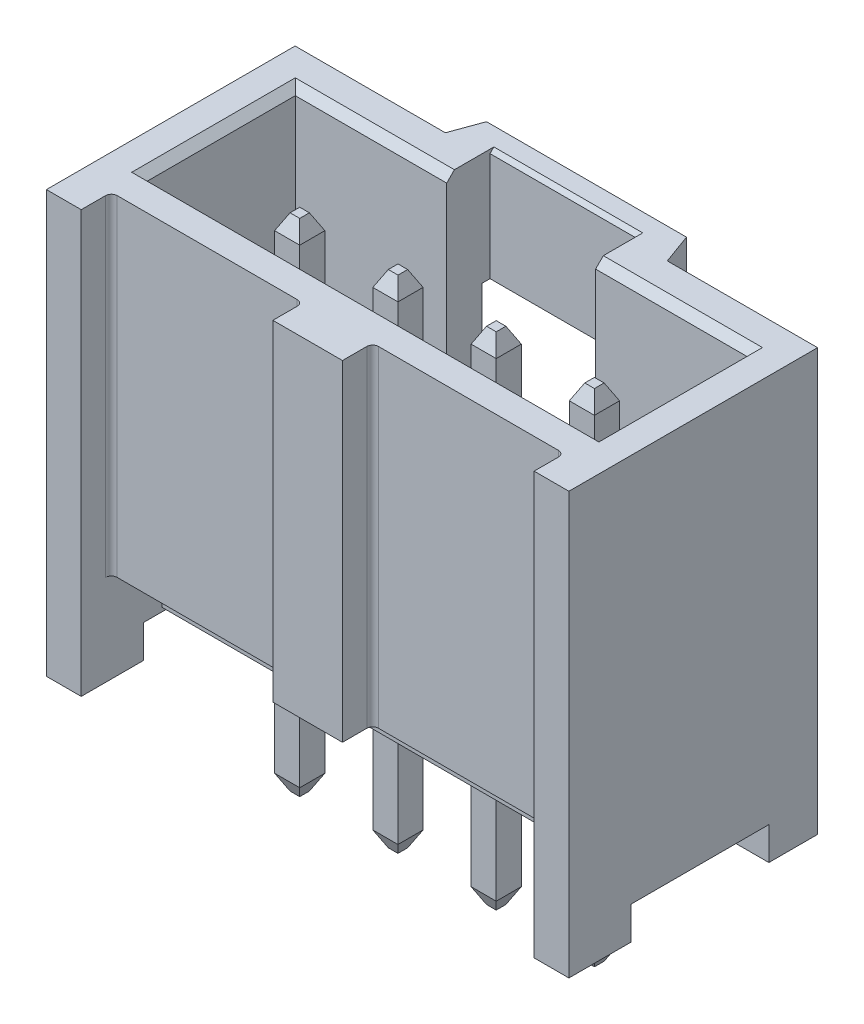
from build123d import *
from OCP.BRepFilletAPI import BRepFilletAPI_MakeChamfer

# Parameters (mm, degrees)
CUT_EXTRUDE1_START       = -8.68
CUT_EXTRUDE1_OUTLINE_W   = 6.64
CUT_EXTRUDE1_OUTLINE_H   = 7.1
CUT_EXTRUDE1_DEPTH       = 4.83
CUT_EXTRUDE1_2_OUTLINE_W = 6.64
CUT_EXTRUDE1_2_OUTLINE_H = 7.1
CUT_EXTRUDE1_2_DEPTH     = 4.83
CUT_EXTRUDE1_START_2     = -3.85
CUT_EXTRUDE1_3_OUTLINE_W = 2.105
CUT_EXTRUDE1_3_OUTLINE_H = 7.1
CUT_EXTRUDE1_3_DEPTH     = 3.85
BOSS_EXTRUDE1_DEPTH      = 2.95
SKETCH3_W                = 3.415
SKETCH3_H                = 7.1
CUT_EXTRUDE2_DEPTH       = 3.915
SKETCH4_W                = 3.415
SKETCH4_H                = 7.1
CUT_EXTRUDE3_DEPTH       = 3.915
SKETCH5_W                = 0.21
SKETCH5_H                = 10.05
CUT_EXTRUDE4_DEPTH       = 4.1696
SKETCH6_W                = 4.83
SKETCH6_H                = 0.21
SKETCH6_W_2              = 0.6604
CUT_EXTRUDE5_DEPTH       = 7.15
SKETCH7_W                = 0.21
SKETCH7_H                = 2.9
CUT_EXTRUDE6_DEPTH       = 4.1696
SKETCH8_W                = 5.1708
SKETCH8_H                = 2.9
BOSS_EXTRUDE2_DEPTH      = 0.57
SKETCH9_W                = 11.71
SKETCH9_H                = 0.78
CUT_EXTRUDE7_DEPTH       = 13.634419259
SKETCH10_W               = 1.8
SKETCH10_H               = 8.55
BOSS_EXTRUDE3_DEPTH      = 0.78
SKETCH11_W               = 11.71
SKETCH11_H               = 1.5
CUT_EXTRUDE8_DEPTH       = 1.31
SKETCH12_W               = 0.9
SKETCH12_H               = 1.61
BOSS_EXTRUDE4_DEPTH      = 0.85
SKETCH13_W               = 0.9
SKETCH13_H               = 1.61
BOSS_EXTRUDE5_DEPTH      = 0.85
CUT_EXTRUDE9_REACH       = 11.866
SKETCH15_W               = 3.85
SKETCH15_H               = 1.5
SKETCH16_W               = 1.74
SKETCH16_H               = 1.5
CUT_EXTRUDE10_DEPTH      = 3.93
SKETCH17_W               = 0.9
SKETCH17_H               = 1.26
BOSS_EXTRUDE6_DEPTH      = 0.85
SKETCH18_W               = 1.74
SKETCH18_H               = 1.5
CUT_EXTRUDE11_DEPTH      = 3.93
SKETCH19_W               = 0.9
SKETCH19_H               = 1.26
BOSS_EXTRUDE7_DEPTH      = 0.85
SKETCH20_W               = 11.68
SKETCH20_H               = 3
CUT_EXTRUDE12_DEPTH      = 0.5
CUT_EXTRUDE13_REACH      = 12.442
SKETCH22_W               = 11.68
SKETCH22_H               = 0.415
SKETCH23_W               = 0.65
SKETCH23_H               = 0.65
BOSS_EXTRUDE8_DEPTH      = 6.75
SKETCH24_W               = 0.65
SKETCH24_H               = 0.65
BOSS_EXTRUDE9_DEPTH      = 6.75
SKETCH25_W               = 0.65
SKETCH25_H               = 0.65
BOSS_EXTRUDE10_DEPTH     = 6.75
SKETCH26_W               = 0.65
SKETCH26_H               = 0.65
BOSS_EXTRUDE11_DEPTH     = 6.75
SKETCH27_W               = 0.65
SKETCH27_H               = 0.65
BOSS_EXTRUDE12_DEPTH     = 3.75
SKETCH28_W               = 0.65
SKETCH28_H               = 0.65
BOSS_EXTRUDE13_DEPTH     = 3.75
SKETCH29_W               = 0.65
SKETCH29_H               = 0.65
BOSS_EXTRUDE14_DEPTH     = 3.75
SKETCH30_W               = 0.65
SKETCH30_H               = 0.65
BOSS_EXTRUDE15_DEPTH     = 3.75
DRAFT1_ANGLE             = 20
CHAMFER1_SIZE            = 0.1
CHAMFER2_SIZE            = 0.2
CHAMFER2_SIZE2           = 0.4
CHAMFER3_SIZE            = 0.2
FILLET1_R                = 0.15


with BuildPart() as part:
    # Cut-Extrude1: read off the stored shape, not the designer's step
    # Cut-Extrude1 outline → Cut-Extrude1 (new body)
    with BuildSketch(Plane(origin=(1.925, 0, 0), x_dir=(0, 0, -1), z_dir=(1, 0, 0)).offset(CUT_EXTRUDE1_START)):
        with Locations((-0.285, 1.9)):
            Rectangle(CUT_EXTRUDE1_OUTLINE_W, CUT_EXTRUDE1_OUTLINE_H)
    extrude(amount=CUT_EXTRUDE1_DEPTH)



with BuildPart() as body_2:
    # Cut-Extrude1 2 outline → Cut-Extrude1 2 (new body)
    with BuildSketch(Plane(origin=(1.925, 0, 0), x_dir=(0, 0, -1), z_dir=(1, 0, 0))):
        with Locations((-0.285, 1.9)):
            Rectangle(CUT_EXTRUDE1_2_OUTLINE_W, CUT_EXTRUDE1_2_OUTLINE_H)
    extrude(amount=CUT_EXTRUDE1_2_DEPTH)


with BuildPart() as part_1:
    add(part.part)

    add(body_2.part)  # Cut-Extrude1 3 merges body 2
    # Cut-Extrude1 3 outline → Cut-Extrude1 3 (add)
    with BuildSketch(Plane(origin=(1.925, 0, 0), x_dir=(0, 0, -1), z_dir=(1, 0, 0)).offset(CUT_EXTRUDE1_START_2)):
        with Locations((-2.5525, 1.9)):
            Rectangle(CUT_EXTRUDE1_3_OUTLINE_W, CUT_EXTRUDE1_3_OUTLINE_H)
    extrude(amount=CUT_EXTRUDE1_3_DEPTH)

    # Sketch2 → Boss-Extrude1 (add)
    with BuildSketch(Plane.XZ.offset(1.65)):
        Polygon((6.755, -3.035), (1.925, -3.035), (1.925, -1.915), (-1.925, -1.915), (-1.925, -3.035), (-6.755, -3.035), (-6.755, 3.605), (6.755, 3.605), align=None)
    extrude(amount=BOSS_EXTRUDE1_DEPTH)

    # Sketch3 → Cut-Extrude2 (cut)
    with BuildSketch(Plane.ZY.offset(-1.925)):
        with Locations((-0.2075, 1.9)):
            Rectangle(SKETCH3_W, SKETCH3_H)
    extrude(amount=-CUT_EXTRUDE2_DEPTH, mode=Mode.SUBTRACT)

    # Sketch4 → Cut-Extrude3 (cut)
    with BuildSketch(Plane(origin=(-1.925, 0, 0), x_dir=(0, 0, -1), z_dir=(1, 0, 0))):
        with Locations((0.2075, 1.9)):
            Rectangle(SKETCH4_W, SKETCH4_H)
    extrude(amount=-CUT_EXTRUDE3_DEPTH, mode=Mode.SUBTRACT)

    # Sketch5 → Cut-Extrude4 (cut)
    with BuildSketch(Plane(origin=(6.755, 0, 0), x_dir=(0, 0, -1), z_dir=(1, 0, 0))):
        with Locations((2.93, 0.425)):
            Rectangle(SKETCH5_W, SKETCH5_H)
    extrude(amount=-CUT_EXTRUDE4_DEPTH, mode=Mode.SUBTRACT)

    # Sketch6 → Cut-Extrude5 (cut)
    with BuildSketch(Plane.XZ.offset(4.6)):
        with Locations((-4.34, -2.93)):
            Rectangle(SKETCH6_W, SKETCH6_H)
        with Locations((2.2552, -2.93)):
            Rectangle(SKETCH6_W_2, SKETCH6_H)
    extrude(amount=-CUT_EXTRUDE5_DEPTH, mode=Mode.SUBTRACT)

    # Sketch7 → Cut-Extrude6 (cut)
    with BuildSketch(Plane.ZY.offset(6.755)):
        with Locations((-2.93, 4)):
            Rectangle(SKETCH7_W, SKETCH7_H)
    extrude(amount=-CUT_EXTRUDE6_DEPTH, mode=Mode.SUBTRACT)

    # Sketch8 → Boss-Extrude2 (add)
    with BuildSketch(Plane(origin=(0, 0, -3.035), x_dir=(-1, 0, 0), z_dir=(0, 0, -1))):
        with Locations((0, 4)):
            Rectangle(SKETCH8_W, SKETCH8_H)
    extrude(amount=BOSS_EXTRUDE2_DEPTH)

    # Sketch9 → Cut-Extrude7 (cut, through all)
    with BuildSketch(Plane.XZ.offset(4.6)):
        with Locations((0, 3.215)):
            Rectangle(SKETCH9_W, SKETCH9_H)
    extrude(amount=-CUT_EXTRUDE7_DEPTH, mode=Mode.SUBTRACT)

    # Sketch10 → Boss-Extrude3 (add)
    with BuildSketch(Plane.XY.offset(2.825)):
        with Locations((0, 1.175)):
            Rectangle(SKETCH10_W, SKETCH10_H)
    extrude(amount=BOSS_EXTRUDE3_DEPTH)

    # Sketch11 → Cut-Extrude8 (cut)
    with BuildSketch(Plane.XY.offset(2.825)):
        with Locations((0, -3.85)):
            Rectangle(SKETCH11_W, SKETCH11_H)
    extrude(amount=-CUT_EXTRUDE8_DEPTH, mode=Mode.SUBTRACT)

    # Sketch12 → Boss-Extrude4 (add)
    with BuildSketch(Plane.XZ.offset(4.6)):
        with Locations((6.305, 2.8)):
            Rectangle(SKETCH12_W, SKETCH12_H)
    extrude(amount=BOSS_EXTRUDE4_DEPTH)

    # Sketch13 → Boss-Extrude5 (add)
    with BuildSketch(Plane.XZ.offset(4.6)):
        with Locations((-6.305, 2.8)):
            Rectangle(SKETCH13_W, SKETCH13_H)
    extrude(amount=BOSS_EXTRUDE5_DEPTH)

    # Sketch15 → Cut-Extrude9 (cut, up to next)
    with BuildSketch(Plane.XY.offset(-1.085), mode=Mode.PRIVATE) as cut_extrude9_sk1:
        with Locations((0, -3.85)):
            Rectangle(SKETCH15_W, SKETCH15_H)
    cut_extrude9_tool1 = extrude(cut_extrude9_sk1.sketch, amount=-CUT_EXTRUDE9_REACH, mode=Mode.PRIVATE) & part_1.part
    add(cut_extrude9_tool1.solids().sort_by_distance((0, -3.85, -1.085))[0], mode=Mode.SUBTRACT)

    # Sketch16 → Cut-Extrude10 (cut)
    with BuildSketch(Plane.ZY.offset(-1.925)):
        with Locations((-1.955, -3.85)):
            Rectangle(SKETCH16_W, SKETCH16_H)
    extrude(amount=-CUT_EXTRUDE10_DEPTH, mode=Mode.SUBTRACT)

    # Sketch17 → Boss-Extrude6 (add)
    with BuildSketch(Plane.XZ.offset(4.6)):
        with Locations((6.305, -2.195)):
            Rectangle(SKETCH17_W, SKETCH17_H)
    extrude(amount=BOSS_EXTRUDE6_DEPTH)

    # Sketch18 → Cut-Extrude11 (cut)
    with BuildSketch(Plane(origin=(-1.925, 0, 0), x_dir=(0, 0, -1), z_dir=(1, 0, 0))):
        with Locations((1.955, -3.85)):
            Rectangle(SKETCH18_W, SKETCH18_H)
    extrude(amount=-CUT_EXTRUDE11_DEPTH, mode=Mode.SUBTRACT)

    # Sketch19 → Boss-Extrude7 (add)
    with BuildSketch(Plane.XZ.offset(4.6)):
        with Locations((-6.305, -2.195)):
            Rectangle(SKETCH19_W, SKETCH19_H)
    extrude(amount=BOSS_EXTRUDE7_DEPTH)

    # Sketch20 → Cut-Extrude12 (cut)
    with BuildSketch(Plane(origin=(0, -1.65, 0), x_dir=(-1, 0, 0), z_dir=(0, 1, 0))):
        Rectangle(SKETCH20_W, SKETCH20_H)
    extrude(amount=-CUT_EXTRUDE12_DEPTH, mode=Mode.SUBTRACT)

    # Sketch22 → Cut-Extrude13 (cut, up to next)
    with BuildSketch(Plane.XZ.offset(1.65), mode=Mode.PRIVATE) as cut_extrude13_sk1:
        with Locations((0, 1.7075)):
            Rectangle(SKETCH22_W, SKETCH22_H)
    cut_extrude13_tool1 = extrude(cut_extrude13_sk1.sketch, amount=-CUT_EXTRUDE13_REACH, mode=Mode.PRIVATE) & part_1.part
    add(cut_extrude13_tool1.solids().sort_by_distance((0, -1.65, 1.7075))[0], mode=Mode.SUBTRACT)

    # Sketch23 → Boss-Extrude8 (add)
    with BuildSketch(Plane(origin=(0, -2.15, 0), x_dir=(-1, 0, 0), z_dir=(0, 1, 0))):
        with Locations((3.81, 0)):
            Rectangle(SKETCH23_W, SKETCH23_H)
    extrude(amount=BOSS_EXTRUDE8_DEPTH)

    # Sketch24 → Boss-Extrude9 (add)
    with BuildSketch(Plane(origin=(0, -2.15, 0), x_dir=(-1, 0, 0), z_dir=(0, 1, 0))):
        with Locations((1.27, 0)):
            Rectangle(SKETCH24_W, SKETCH24_H)
    extrude(amount=BOSS_EXTRUDE9_DEPTH)

    # Sketch25 → Boss-Extrude10 (add)
    with BuildSketch(Plane(origin=(0, -2.15, 0), x_dir=(-1, 0, 0), z_dir=(0, 1, 0))):
        with Locations((-1.27, 0)):
            Rectangle(SKETCH25_W, SKETCH25_H)
    extrude(amount=BOSS_EXTRUDE10_DEPTH)

    # Sketch26 → Boss-Extrude11 (add)
    with BuildSketch(Plane(origin=(0, -2.15, 0), x_dir=(-1, 0, 0), z_dir=(0, 1, 0))):
        with Locations((-3.81, 0)):
            Rectangle(SKETCH26_W, SKETCH26_H)
    extrude(amount=BOSS_EXTRUDE11_DEPTH)

    # Sketch27 → Boss-Extrude12 (add)
    with BuildSketch(Plane.XZ.offset(4.6)):
        with Locations((-3.81, 0)):
            Rectangle(SKETCH27_W, SKETCH27_H)
    extrude(amount=BOSS_EXTRUDE12_DEPTH)

    # Sketch28 → Boss-Extrude13 (add)
    with BuildSketch(Plane.XZ.offset(4.6)):
        with Locations((-1.27, 0)):
            Rectangle(SKETCH28_W, SKETCH28_H)
    extrude(amount=BOSS_EXTRUDE13_DEPTH)

    # Sketch29 → Boss-Extrude14 (add)
    with BuildSketch(Plane.XZ.offset(4.6)):
        with Locations((1.27, 0)):
            Rectangle(SKETCH29_W, SKETCH29_H)
    extrude(amount=BOSS_EXTRUDE14_DEPTH)

    # Sketch30 → Boss-Extrude15 (add)
    with BuildSketch(Plane.XZ.offset(4.6)):
        with Locations((3.81, 0)):
            Rectangle(SKETCH30_W, SKETCH30_H)
    extrude(amount=BOSS_EXTRUDE15_DEPTH)

    # Draft1
    draft1_faces = [part_1.faces().sort_by_distance(p)[0] for p in [
        (-2.5854, 4, -3.215),
        (2.5854, 4, -3.215),
    ]]
    draft(draft1_faces, Plane(origin=(0, 0, -3.605), x_dir=(-1, 0, 0), z_dir=(0, 0, -1)), DRAFT1_ANGLE)

    # Chamfer1
    chamfer1_edges = [part_1.edges().sort_by_distance(p)[0] for p in [
        (0, 5.45, -3.035),
        (0, -4.6, 1.515),
        (0, -4.6, -1.085),
    ]]
    chamfer(chamfer1_edges, length=CHAMFER1_SIZE)

    # Chamfer2: one chamfer whose edges measure the first distance from different faces: ONE call of the kernel's chamfer builder (chamfer() names one face for all edges)
    chamfer2_edges_1 = [part_1.edges().sort_by_distance(p)[0] for p in [
        (-4.135, 4.6, 0),
        (-3.81, 4.6, 0.325),
        (-3.485, 4.6, 0),
        (-3.81, 4.6, -0.325),
    ]]
    chamfer2_side_1 = [part_1.faces().sort_by_distance(p)[0] for p in [
        (-3.81, 4.6, 0),
    ]]
    chamfer2_edges_2 = [part_1.edges().sort_by_distance(p)[0] for p in [
        (-1.27, 4.6, -0.325),
        (-1.595, 4.6, 0),
        (-1.27, 4.6, 0.325),
        (-0.945, 4.6, 0),
    ]]
    chamfer2_side_2 = [part_1.faces().sort_by_distance(p)[0] for p in [
        (-1.27, 4.6, 0),
    ]]
    chamfer2_edges_3 = [part_1.edges().sort_by_distance(p)[0] for p in [
        (0.945, 4.6, 0),
        (1.27, 4.6, 0.325),
        (1.595, 4.6, 0),
        (1.27, 4.6, -0.325),
    ]]
    chamfer2_side_3 = [part_1.faces().sort_by_distance(p)[0] for p in [
        (1.27, 4.6, 0),
    ]]
    chamfer2_edges_4 = [part_1.edges().sort_by_distance(p)[0] for p in [
        (3.81, 4.6, -0.325),
        (3.485, 4.6, 0),
        (3.81, 4.6, 0.325),
        (4.135, 4.6, 0),
    ]]
    chamfer2_side_4 = [part_1.faces().sort_by_distance(p)[0] for p in [
        (3.81, 4.6, 0),
    ]]
    chamfer2_edges_5 = [part_1.edges().sort_by_distance(p)[0] for p in [
        (-3.81, -8.35, -0.325),
        (-3.485, -8.35, 0),
        (-3.81, -8.35, 0.325),
        (-4.135, -8.35, 0),
    ]]
    chamfer2_side_5 = [part_1.faces().sort_by_distance(p)[0] for p in [
        (-3.81, -8.35, 0),
    ]]
    chamfer2_edges_6 = [part_1.edges().sort_by_distance(p)[0] for p in [
        (-1.27, -8.35, -0.325),
        (-0.945, -8.35, 0),
        (-1.27, -8.35, 0.325),
        (-1.595, -8.35, 0),
    ]]
    chamfer2_side_6 = [part_1.faces().sort_by_distance(p)[0] for p in [
        (-1.27, -8.35, 0),
    ]]
    chamfer2_edges_7 = [part_1.edges().sort_by_distance(p)[0] for p in [
        (1.27, -8.35, -0.325),
        (1.595, -8.35, 0),
        (1.27, -8.35, 0.325),
        (0.945, -8.35, 0),
    ]]
    chamfer2_side_7 = [part_1.faces().sort_by_distance(p)[0] for p in [
        (1.27, -8.35, 0),
    ]]
    chamfer2_edges_8 = [part_1.edges().sort_by_distance(p)[0] for p in [
        (4.135, -8.35, 0),
        (3.81, -8.35, 0.325),
        (3.485, -8.35, 0),
        (3.81, -8.35, -0.325),
    ]]
    chamfer2_side_8 = [part_1.faces().sort_by_distance(p)[0] for p in [
        (3.81, -8.35, 0),
    ]]
    chamfer2 = BRepFilletAPI_MakeChamfer(part_1.part.solid().wrapped)
    for e in chamfer2_edges_1:
        chamfer2.Add(CHAMFER2_SIZE, CHAMFER2_SIZE2, e.wrapped, chamfer2_side_1[0].wrapped)  # the first distance lies on this face
    for e in chamfer2_edges_2:
        chamfer2.Add(CHAMFER2_SIZE, CHAMFER2_SIZE2, e.wrapped, chamfer2_side_2[0].wrapped)  # the first distance lies on this face
    for e in chamfer2_edges_3:
        chamfer2.Add(CHAMFER2_SIZE, CHAMFER2_SIZE2, e.wrapped, chamfer2_side_3[0].wrapped)  # the first distance lies on this face
    for e in chamfer2_edges_4:
        chamfer2.Add(CHAMFER2_SIZE, CHAMFER2_SIZE2, e.wrapped, chamfer2_side_4[0].wrapped)  # the first distance lies on this face
    for e in chamfer2_edges_5:
        chamfer2.Add(CHAMFER2_SIZE, CHAMFER2_SIZE2, e.wrapped, chamfer2_side_5[0].wrapped)  # the first distance lies on this face
    for e in chamfer2_edges_6:
        chamfer2.Add(CHAMFER2_SIZE, CHAMFER2_SIZE2, e.wrapped, chamfer2_side_6[0].wrapped)  # the first distance lies on this face
    for e in chamfer2_edges_7:
        chamfer2.Add(CHAMFER2_SIZE, CHAMFER2_SIZE2, e.wrapped, chamfer2_side_7[0].wrapped)  # the first distance lies on this face
    for e in chamfer2_edges_8:
        chamfer2.Add(CHAMFER2_SIZE, CHAMFER2_SIZE2, e.wrapped, chamfer2_side_8[0].wrapped)  # the first distance lies on this face
    add(Compound.cast(chamfer2.Shape()), mode=Mode.REPLACE)

    # Chamfer3
    chamfer3_edges = [part_1.edges().sort_by_distance(p)[0] for p in [
        (5.84, 5.45, 0),
        (3.8825, 5.45, -1.915),
        (-5.84, 5.45, 0),
        (-3.8825, 5.45, -1.915),
        (0, 5.45, 1.915),
    ]]
    chamfer(chamfer3_edges, length=CHAMFER3_SIZE)

    # Fillet1
    fillet1_edges = [part_1.edges().sort_by_distance(p)[0] for p in [
        (5.855, 1.175, 2.825),
        (-5.855, 1.175, 2.825),
        (-0.9, 1.175, 2.825),
        (0.9, 1.175, 2.825),
    ]]
    fillet(fillet1_edges, radius=FILLET1_R)


solid = part_1.part
